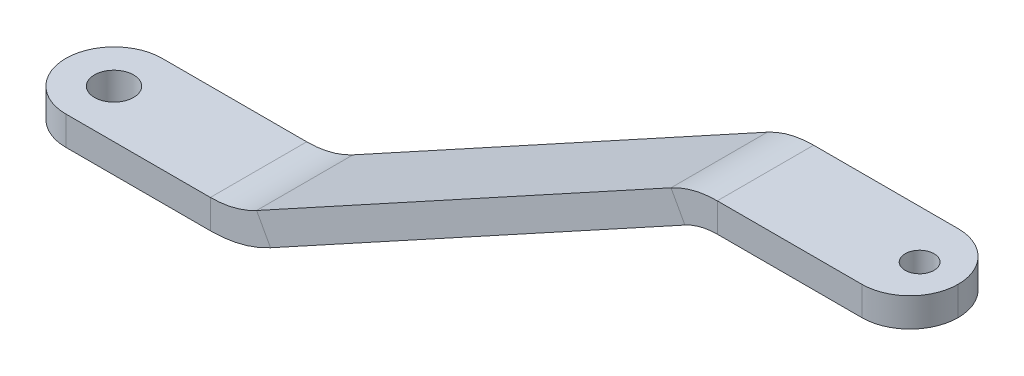
from build123d import *

# Parameters (mm, degrees)
SKETCH3_W          = 10
SKETCH3_H          = 3
SKETCH5_R          = 1.5
CUT_EXTRUDE2_DEPTH = 57.489403968
SKETCH2_R          = 2.032
CUT_EXTRUDE1_DEPTH = 56.009569719
FILLET1_R          = 5


with BuildPart() as part:
    # Sweep1: sweep along a path in Sketch4
    with BuildLine(Plane.XY) as sweep1_path:
        Line((-45.175097276, 1.5), (-25.175097276, 1.5))
        ThreePointArc((-25.175097276, 1.5), (-22.696809318, 1.811961561), (-20.373147477, 2.72838224))
        Line((-20.373147477, 2.72838224), (22.632771246, 26.27161776))
        ThreePointArc((22.632771246, 26.27161776), (24.956433088, 27.188038439), (27.434721046, 27.5))
        Line((27.434721046, 27.5), (47.434721046, 27.5))
    # Sketch3 → Sweep1 (sweep)
    with BuildSketch(Plane.ZY.offset(45.175097276)):
        with Locations((5, 0)):
            Rectangle(SKETCH3_W, SKETCH3_H)
    sweep(path=sweep1_path.line)

    # Sketch5 → Cut-Extrude2 (cut, through all)
    with BuildSketch(Plane(origin=(0, 27.5, 0), x_dir=(1, 0, 0), z_dir=(0, 1, 0))):
        with Locations(Location((43.434721046, -5, 0), (0, 0, 180))):
            Circle(SKETCH5_R)
    extrude(amount=-CUT_EXTRUDE2_DEPTH, mode=Mode.SUBTRACT)

    # Sketch2 → Cut-Extrude1 (cut, through all)
    with BuildSketch(Plane(origin=(0, 1.5, 0), x_dir=(1, 0, 0), z_dir=(0, 1, 0))):
        with Locations(Location((-40.175097276, -5, 0), (0, 0, 270))):
            Circle(SKETCH2_R)
    extrude(amount=-CUT_EXTRUDE1_DEPTH, mode=Mode.SUBTRACT)

    # Fillet1
    fillet1_edges = [part.edges().sort_by_distance(p)[0] for p in [
        (47.434721046, 26, 0),
        (47.434721046, 26, 10),
        (-45.175097276, 0, 10),
        (-45.175097276, 0, 0),
    ]]
    fillet(fillet1_edges, radius=FILLET1_R - 0.0001)  # a hair under: the kernel refuses the full size


solid = part.part
